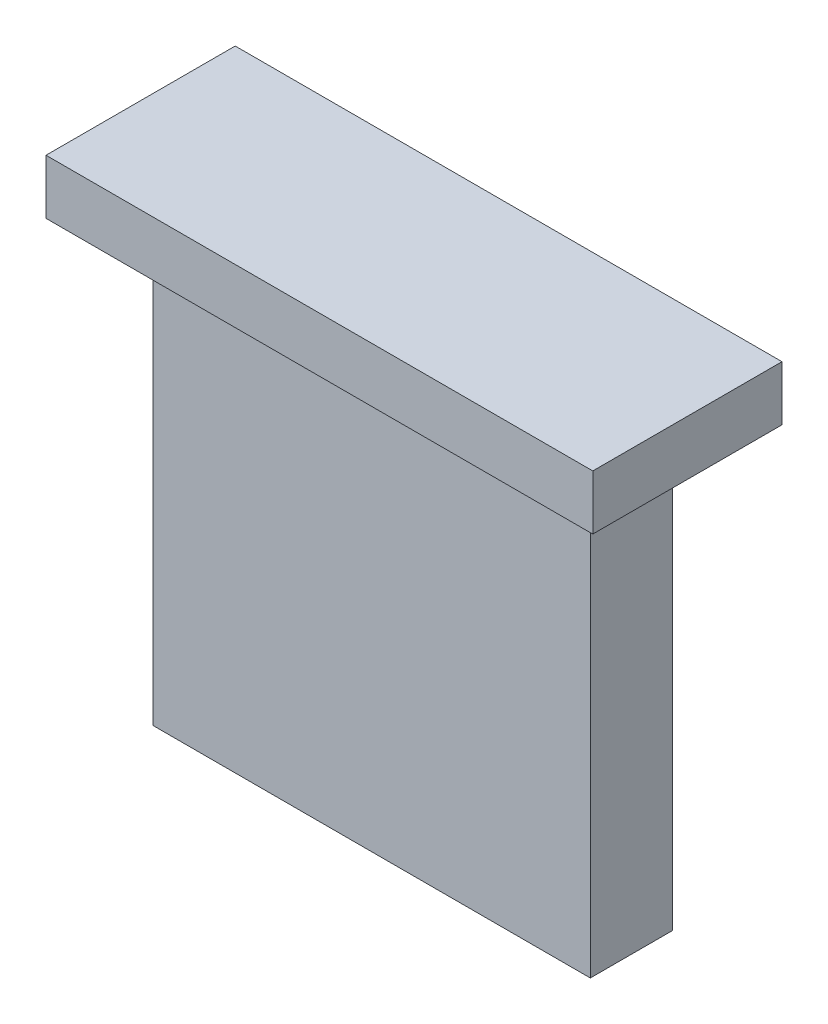
from build123d import *

# Parameters (mm, degrees)
SKETCH1_W           = 8
SKETCH1_H           = 1.5
BOSS_EXTRUDE1_DEPTH = 8
BOSS_EXTRUDE2_DEPTH = 1


with BuildPart() as part:
    # Sketch1 → Boss-Extrude1 (new body)
    with BuildSketch(Plane(origin=(0, 0, 0), x_dir=(1, 0, 0), z_dir=(0, 1, 0))):
        with Locations((4, 0.75)):
            Rectangle(SKETCH1_W, SKETCH1_H)
    extrude(amount=BOSS_EXTRUDE1_DEPTH)

    # Sketch2 → Boss-Extrude2 (add)
    with BuildSketch(Plane(origin=(0, 8, 0), x_dir=(1, 0, 0), z_dir=(0, 1, 0))):
        Polygon((-1.009054121, 2.514302242), (-1.009054121, 1.5), (-1.009054121, -0.946059443), (8.990945879, -0.946059443), (8.990945879, 2.514302242), align=None)
    extrude(amount=BOSS_EXTRUDE2_DEPTH)


solid = part.part
